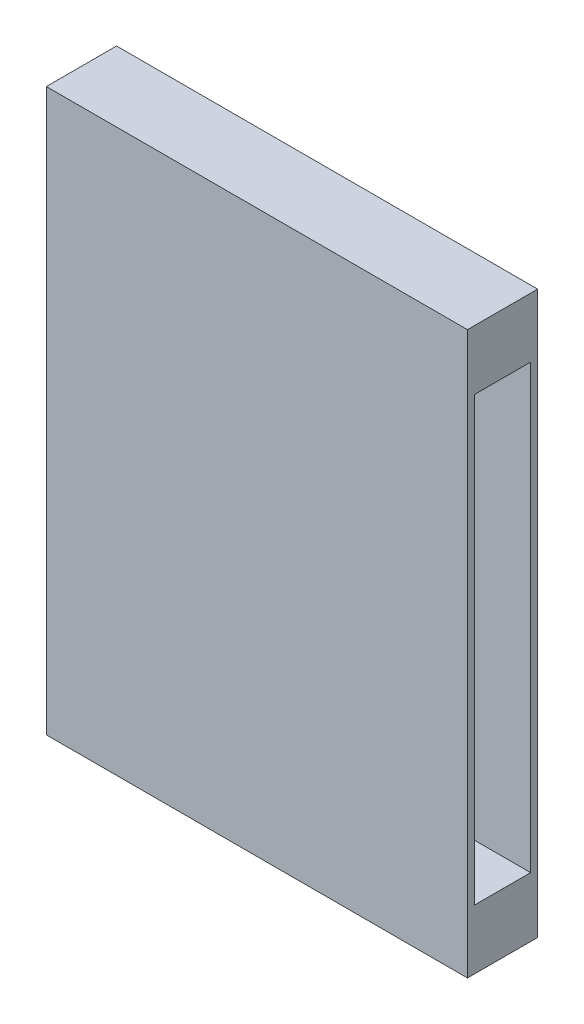
from build123d import *

# Parameters (mm, degrees)
SKETCH1_W           = 30
SKETCH1_H           = 40
BOSS_EXTRUDE1_DEPTH = 5
SKETCH2_W           = 4
SKETCH2_H           = 39
CUT_EXTRUDE1_DEPTH  = 21
SKETCH3_W           = 4
SKETCH3_H           = 31.5
CUT_EXTRUDE2_DEPTH  = 21


with BuildPart() as part:
    # Sketch1 → Boss-Extrude1 (new body)
    with BuildSketch(Plane.XY):
        with Locations((15, 20)):
            Rectangle(SKETCH1_W, SKETCH1_H)
    extrude(amount=BOSS_EXTRUDE1_DEPTH)

    # Sketch2 → Cut-Extrude1 (cut)
    with BuildSketch(Plane.ZY):
        with Locations((2.5, 20)):
            Rectangle(SKETCH2_W, SKETCH2_H)
    extrude(amount=-CUT_EXTRUDE1_DEPTH, mode=Mode.SUBTRACT)

    # Sketch3 → Cut-Extrude2 (cut)
    with BuildSketch(Plane(origin=(30, 0, 0), x_dir=(0, 0, -1), z_dir=(1, 0, 0))):
        with Locations((-2.5, 20)):
            Rectangle(SKETCH3_W, SKETCH3_H)
    extrude(amount=-CUT_EXTRUDE2_DEPTH, mode=Mode.SUBTRACT)


solid = part.part
